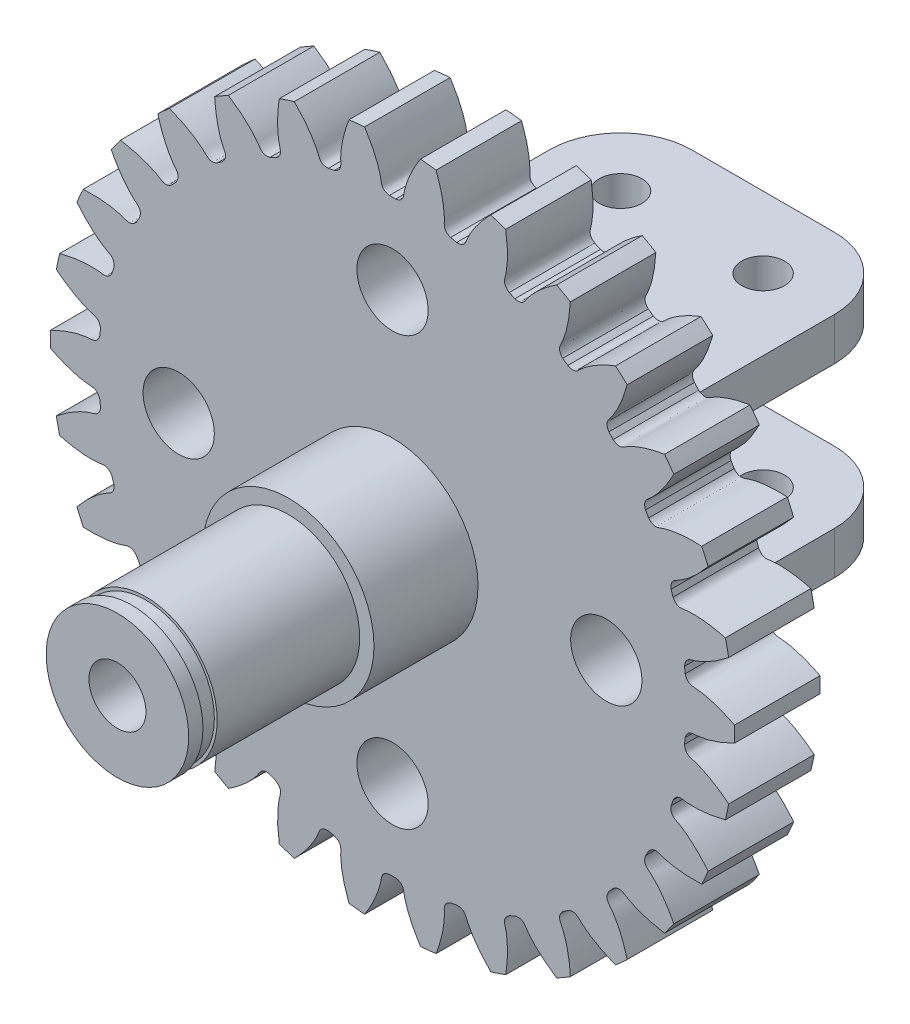
from build123d import *

# Parameters (mm, degrees)
SKETCH_1_R               = 24
EXTRUDE_1_DEPTH          = 6
CUT_EXTRUDE_1_DEPTH      = 35.467375879
PATTERN_CIRCULAR_1_COUNT = 30
SKETCH_4_R               = 6
EXTRUDE_2_DEPTH          = 7.3
SKETCH_5_R               = 5
EXTRUDE_3_DEPTH          = 12
SKETCH_6_W               = 20
SKETCH_6_H               = 3
EXTRUDE_4_DEPTH          = 20
SKETCH_7_R               = 1.5
CUT_EXTRUDE_2_DEPTH      = 20
FILLET_1_R               = 5
CUT_EXTRUDE_START        = -1
SKETCH_8_R               = 5
SKETCH_8_R_2             = 4.8
CUT_EXTRUDE_3_DEPTH      = 1
SKETCH_9_R               = 2
CUT_EXTRUDE_4_DEPTH      = 57.570785982
SKETCH_10_R              = 2.5
CUT_EXTRUDE_5_DEPTH      = 11


with BuildPart() as part:
    # 草图1 → 凸台-拉伸1 (new body)
    with BuildSketch(Plane.XY):
        Circle(SKETCH_1_R)
    extrude(amount=EXTRUDE_1_DEPTH)

    # 草图2 → 切除-拉伸1 (cut, through all)
    with BuildSketch(Plane.XY):
        with BuildLine():
            ThreePointArc((0.218337943, 20.623844296), (0, 20.625), (-0.218337943, 20.623844296))
            add(Edge.make_bspline(
                [(-0.218337943, 20.623844296), (-0.762346034, 20.719462755), (-0.76545712, 21.070698954), (-0.83847723, 21.432868523), (-0.854926112, 21.507193856), (-0.874870629, 21.589387364), (-0.898601576, 21.679346988), (-0.926445936, 21.776947361), (-0.958715037, 21.882057771), (-0.995720269, 21.994536716), (-1.037767941, 22.114233691), (-1.085160513, 22.240988783), (-1.138195901, 22.374632925), (-1.197167364, 22.514987974), (-1.262363223, 22.66186684), (-1.334066627, 22.815073613), (-1.412555321, 22.974403691), (-1.498101405, 23.139643929), (-1.590971111, 23.310572775), (-1.691424568, 23.486960424), (-1.79971559, 23.668568976), (-1.916091444, 23.855152596), (-2.040792645, 24.046457683), (-2.174052743, 24.242223041), (-2.31609811, 24.442180061), (-2.467147746, 24.6460529), (-2.627413076, 24.853558674), (-2.797097758, 25.064407647), (-2.976397494, 25.278303435), (-3.165499848, 25.494943205), (-3.364584064, 25.714017885), (-3.573820897, 25.935212377), (-3.793372437, 26.158205771), (-4.023391966, 26.38267157), (-4.264023724, 26.608277918), (-4.603385799, 26.913931243), (-4.868016928, 27.138107297), (-5.049467747, 27.285837184)],
                knots=[0, 0, 0, 0, 0.115323882, 0.12341257, 0.132512303, 0.142623081, 0.153744905, 0.165877774, 0.179021689, 0.193176649, 0.208342655, 0.224519706, 0.241707802, 0.259906945, 0.279117132, 0.299338365, 0.320570644, 0.342813968, 0.366068337, 0.390333752, 0.415610213, 0.441897719, 0.46919627, 0.497505867, 0.52682651, 0.557158198, 0.588500931, 0.62085471, 0.654219534, 0.688595404, 0.723982319, 0.76038028, 0.797789286, 0.836209338, 0.875640435, 0.916082578, 1, 1, 1, 1], degree=3))
            ThreePointArc((-5.049467747, 27.285837184), (0, 27.74912675), (5.049467747, 27.285837184))
            add(Edge.make_bspline(
                [(0.218337943, 20.623844296), (0.762346034, 20.719462755), (0.76545712, 21.070698954), (0.83847723, 21.432868523), (0.854926112, 21.507193856), (0.874870629, 21.589387364), (0.898601576, 21.679346988), (0.926445936, 21.776947361), (0.958715037, 21.882057771), (0.995720269, 21.994536716), (1.037767941, 22.114233691), (1.085160513, 22.240988783), (1.138195901, 22.374632925), (1.197167364, 22.514987974), (1.262363223, 22.66186684), (1.334066627, 22.815073613), (1.412555321, 22.974403691), (1.498101405, 23.139643929), (1.590971111, 23.310572775), (1.691424568, 23.486960424), (1.79971559, 23.668568976), (1.916091444, 23.855152596), (2.040792645, 24.046457683), (2.174052743, 24.242223041), (2.31609811, 24.442180061), (2.467147746, 24.6460529), (2.627413076, 24.853558674), (2.797097758, 25.064407647), (2.976397494, 25.278303435), (3.165499848, 25.494943205), (3.364584064, 25.714017885), (3.573820897, 25.935212377), (3.793372437, 26.158205771), (4.023391966, 26.38267157), (4.264023724, 26.608277918), (4.603385799, 26.913931243), (4.868016928, 27.138107297), (5.049467747, 27.285837184)],
                knots=[0, 0, 0, 0, 0.115323882, 0.12341257, 0.132512303, 0.142623081, 0.153744905, 0.165877774, 0.179021689, 0.193176649, 0.208342655, 0.224519706, 0.241707802, 0.259906945, 0.279117132, 0.299338365, 0.320570644, 0.342813968, 0.366068337, 0.390333752, 0.415610213, 0.441897719, 0.46919627, 0.497505867, 0.52682651, 0.557158198, 0.588500931, 0.62085471, 0.654219534, 0.688595404, 0.723982319, 0.76038028, 0.797789286, 0.836209338, 0.875640435, 0.916082578, 1, 1, 1, 1], degree=3))
        make_face()
    cut_extrude_1 = extrude(amount=CUT_EXTRUDE_1_DEPTH, mode=Mode.SUBTRACT)

    # 阵列(圆周)1: 切除-拉伸1 ×30 about axis
    pattern_circular_1_axis = Axis((0, 0, 6), (0, 0, -1))
    for i in range(1, PATTERN_CIRCULAR_1_COUNT):
        add(cut_extrude_1.rotate(pattern_circular_1_axis, i * 360 / PATTERN_CIRCULAR_1_COUNT), mode=Mode.SUBTRACT)

    # 草图4 → 凸台-拉伸2 (add)
    with BuildSketch(Plane.XY.offset(6)):
        Circle(SKETCH_4_R)
    extrude(amount=EXTRUDE_2_DEPTH)

    # 草图5 → 凸台-拉伸3 (add)
    with BuildSketch(Plane.XY.offset(13.3)):
        Circle(SKETCH_5_R)
    extrude(amount=EXTRUDE_3_DEPTH)

    # 草图6 → 凸台-拉伸4 (add)
    with BuildSketch(Plane(origin=(0, 0, 0), x_dir=(-1, 0, 0), z_dir=(0, 0, -1))):
        with Locations((0, 6.5)):
            Rectangle(SKETCH_6_W, SKETCH_6_H)
        with Locations((0, -6.5)):
            Rectangle(SKETCH_6_W, SKETCH_6_H)
    extrude(amount=EXTRUDE_4_DEPTH)

    # 草图7 → 切除-拉伸2 (cut)
    with BuildSketch(Plane(origin=(0, 8, 0), x_dir=(1, 0, 0), z_dir=(0, 1, 0))):
        with Locations((5, 15)):
            Circle(SKETCH_7_R)
        with Locations((5, 5)):
            Circle(SKETCH_7_R)
        with Locations((-5, 5)):
            Circle(SKETCH_7_R)
        with Locations((-5, 15)):
            Circle(SKETCH_7_R)
    extrude(amount=-CUT_EXTRUDE_2_DEPTH, mode=Mode.SUBTRACT)

    # 圆角1
    fillet_1_edges = [part.edges().sort_by_distance(p)[0] for p in [
        (-10, -6.5, -20),
        (-10, 6.5, -20),
        (10, 6.5, -20),
        (10, -6.5, -20),
    ]]
    fillet(fillet_1_edges, radius=FILLET_1_R)

    # 草图8 → 切除-拉伸3 (cut)
    with BuildSketch(Plane.XY.offset(24.3).offset(CUT_EXTRUDE_START)):
        Circle(SKETCH_8_R)
        Circle(SKETCH_8_R_2, mode=Mode.SUBTRACT)
    extrude(amount=CUT_EXTRUDE_3_DEPTH, mode=Mode.SUBTRACT)

    # 草图9 → 切除-拉伸4 (cut, through all)
    with BuildSketch(Plane.XY.offset(25.3)):
        Circle(SKETCH_9_R)
    extrude(amount=-CUT_EXTRUDE_4_DEPTH, mode=Mode.SUBTRACT)

    # 草图10 → 切除-拉伸5 (cut)
    with BuildSketch(Plane.XY.offset(6)):
        with Locations((0, 15)):
            Circle(SKETCH_10_R)
        with Locations((-15, 0)):
            Circle(SKETCH_10_R)
        with Locations((0, -15)):
            Circle(SKETCH_10_R)
        with Locations((15, 0)):
            Circle(SKETCH_10_R)
    extrude(amount=-CUT_EXTRUDE_5_DEPTH, mode=Mode.SUBTRACT)


solid = part.part
